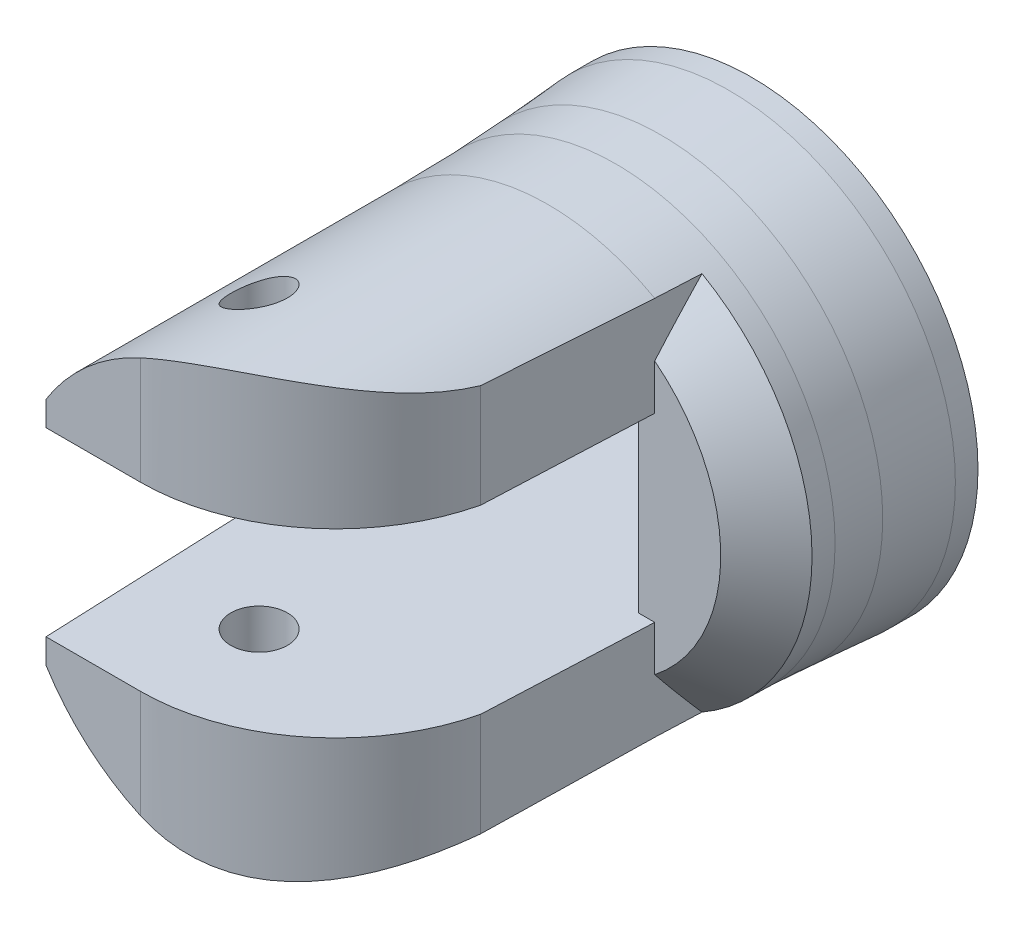
from build123d import *

# Parameters (mm, degrees)
SKETCH1_R               = 10
BOSS_EXTRUDE1_DEPTH     = 1
SKETCH2_R               = 10
BOSS_EXTRUDE2_DEPTH     = 3
BOSS_EXTRUDE2_TAPER     = 4
SKETCH3_R               = 9.790219564
BOSS_EXTRUDE3_DEPTH     = 2
BOSS_EXTRUDE3_TAPER     = 3
SKETCH4_R               = 9.685404006
BOSS_EXTRUDE4_DEPTH     = 3
BOSS_EXTRUDE4_TAPER     = 1
SKETCH5_R               = 9.633038811
BOSS_EXTRUDE5_DEPTH     = 14
CUT_EXTRUDE1_DEPTH      = 13
CUT_EXTRUDE1_DEPTH_BACK = 13
SKETCH6_W               = 17.15
SKETCH6_H               = 8
CUT_EXTRUDE2_DEPTH      = 13
CUT_EXTRUDE2_DEPTH_BACK = 13
SKETCH8_W               = 8
SKETCH8_H               = 8
CUT_EXTRUDE3_DEPTH      = 13
SKETCH9_R               = 1.25
CUT_EXTRUDE4_DEPTH      = 11
CHAMFER1_SIZE           = 2


with BuildPart() as part:
    # Sketch1 → Boss-Extrude1 (new body)
    with BuildSketch(Plane.XY):
        Circle(SKETCH1_R)
    extrude(amount=BOSS_EXTRUDE1_DEPTH)

    # Sketch2 → Boss-Extrude2 (add)
    with BuildSketch(Plane.XY.offset(1)):
        Circle(SKETCH2_R)
    extrude(amount=BOSS_EXTRUDE2_DEPTH, taper=BOSS_EXTRUDE2_TAPER)

    # Sketch3 → Boss-Extrude3 (add)
    with BuildSketch(Plane.XY.offset(4)):
        Circle(SKETCH3_R)
    extrude(amount=BOSS_EXTRUDE3_DEPTH, taper=BOSS_EXTRUDE3_TAPER)

    # Sketch4 → Boss-Extrude4 (add)
    with BuildSketch(Plane.XY.offset(6)):
        Circle(SKETCH4_R)
    extrude(amount=BOSS_EXTRUDE4_DEPTH, taper=BOSS_EXTRUDE4_TAPER)

    # Sketch5 → Boss-Extrude5 (add)
    with BuildSketch(Plane.XY.offset(9)):
        Circle(SKETCH5_R)
    extrude(amount=BOSS_EXTRUDE5_DEPTH)

    # Sketch6 → Cut-Extrude1 (cut, two sides: drawn at the far end of the back side and taken through both)
    with BuildSketch(Plane(origin=(0, 0, 0), x_dir=(0, 0, -1), z_dir=(1, 0, 0)).offset(-CUT_EXTRUDE1_DEPTH_BACK)):
        with Locations((-17.575, 0)):
            Rectangle(SKETCH6_W, SKETCH6_H)
    extrude(amount=CUT_EXTRUDE1_DEPTH + CUT_EXTRUDE1_DEPTH_BACK, mode=Mode.SUBTRACT)

    # Sketch7 → Cut-Extrude2 (cut, two sides: drawn at the far end of the back side and taken through both)
    with BuildSketch(Plane(origin=(0, 0, 0), x_dir=(1, 0, 0), z_dir=(0, 1, 0)).offset(-CUT_EXTRUDE2_DEPTH_BACK)):
        with BuildLine():
            Line((-8.763300561, -9), (-10.263300561, -9))
            Line((-10.263300561, -9), (-10.263300561, -28.451581468))
            Line((-10.263300561, -28.451581468), (9.633038811, -28.451581468))
            Line((9.633038811, -28.451581468), (9.633038811, -9))
            Line((9.633038811, -9), (4.716699439, -9))
            Line((4.716699439, -9), (4.388453733, -16.36))
            ThreePointArc((4.388453733, -16.36), (1.343744491, -21.139438677), (-4.008974444, -23))
            Line((-4.008974444, -23), (-8.178974444, -23))
            Line((-8.178974444, -23), (-8.763300561, -9))
        make_face()
    extrude(amount=CUT_EXTRUDE2_DEPTH + CUT_EXTRUDE2_DEPTH_BACK, mode=Mode.SUBTRACT)

    # Sketch8 → Cut-Extrude3 (cut)
    with BuildSketch(Plane(origin=(0, 0, 0), x_dir=(-1, 0, 0), z_dir=(0, 0, -1))):
        Rectangle(SKETCH8_W, SKETCH8_H)
    extrude(amount=-CUT_EXTRUDE3_DEPTH, mode=Mode.SUBTRACT)

    # Sketch9 → Cut-Extrude4 (cut, symmetric)
    with BuildSketch(Plane(origin=(0, 0, 0), x_dir=(1, 0, 0), z_dir=(0, 1, 0))):
        with Locations(Location((-3.763300561, -18, 0), (0, 0, 270))):
            Circle(SKETCH9_R)
    extrude(amount=CUT_EXTRUDE4_DEPTH, both=True, mode=Mode.SUBTRACT)

    # Chamfer1
    # the kernel refuses this chamfer: 2 mm, written as the material it takes off along each edge
    with BuildSketch(Plane(origin=(0, 0, 9), x_dir=(-0.022475112384337453, 0.9997474027589727, 0), z_dir=(-0.9997474027589727, -0.022475112384337453, 0))) as chamfer1_piece_1_section:
        Polygon((9.633038811 - CHAMFER1_SIZE, 0), (9.633038811 + CHAMFER1_SIZE * 0.0174524064372, CHAMFER1_SIZE * 0.999847695156), (9.633038811, 0), align=None)
    chamfer1_piece_1 = revolve(axis=Axis((0, 0, 9), (0, 0, -1)), revolution_arc=91.28783752, mode=Mode.PRIVATE)
    chamfer1_piece_1 = split(chamfer1_piece_1, bisect_by=Plane(origin=(4.752278324, 4.191519128, 8.202242122), z_dir=(0.9990069635270563, 0, 0.0445543131969368)), keep=Keep.TOP, mode=Mode.PRIVATE)
    add(chamfer1_piece_1, mode=Mode.SUBTRACT)
    with BuildSketch(Plane(origin=(0, 0, 9), x_dir=(1, 0, 0), z_dir=(0, 1, 0))) as chamfer1_piece_2_section:
        Polygon((9.633038811 - CHAMFER1_SIZE, 0), (9.633038811 + CHAMFER1_SIZE * 0.0174524064373, CHAMFER1_SIZE * 0.999847695156), (9.633038811, 0), align=None)
    chamfer1_piece_2 = revolve(axis=Axis((0, 0, 9), (0, 0, -1)), revolution_arc=91.28783752, mode=Mode.PRIVATE)
    chamfer1_piece_2 = split(chamfer1_piece_2, bisect_by=Plane(origin=(4.752278326, -4.191519128, 8.202242073), z_dir=(0.9990069635270563, 0, 0.0445543131969368)), keep=Keep.TOP, mode=Mode.PRIVATE)
    add(chamfer1_piece_2, mode=Mode.SUBTRACT)


solid = part.part
